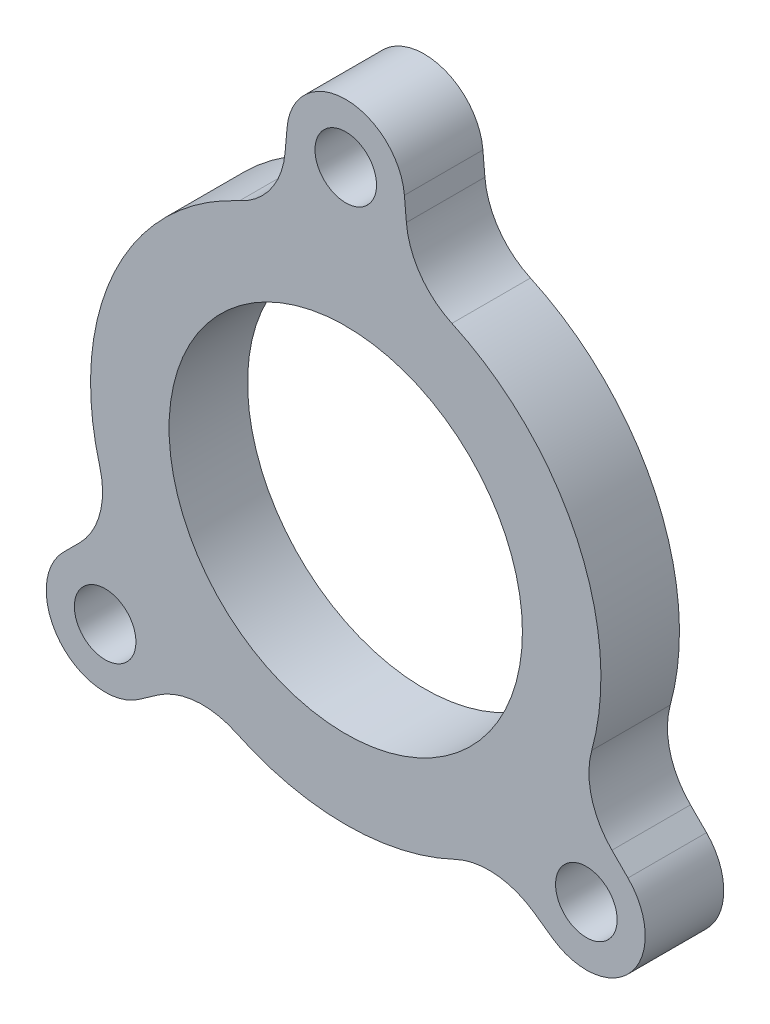
from build123d import *

# Parameters (mm, degrees)
SKETCH1_R           = 2.4892
SKETCH1_R_2         = 14.2875
BOSS_EXTRUDE1_DEPTH = 3.175
FILLET1_R           = 6.35


with BuildPart() as part:
    # Sketch1 → Boss-Extrude1 (new, symmetric)
    with BuildSketch(Plane.XY):
        with BuildLine():
            Line((-4.74437725, 25.815079225), (-5.256916026, 19.956734205))
            ThreePointArc((-5.256916026, 19.956734205), (-18.703926955, 8.721784377), (-18.666825827, -8.800910167))
            Line((-18.666825827, -8.800910167), (-22.825124901, -12.959209241))
            ThreePointArc((-22.825124901, -12.959209241), (-23.105815516, -19.388081277), (-16.725871077, -20.228016897))
            Line((-16.725871077, -20.228016897), (-11.908664854, -16.854972787))
            ThreePointArc((-11.908664854, -16.854972787), (0, -20.6375), (11.908664854, -16.854972787))
            Line((11.908664854, -16.854972787), (16.725871077, -20.228016897))
            ThreePointArc((16.725871077, -20.228016897), (23.105815516, -19.388081277), (22.825124901, -12.959209241))
            Line((22.825124901, -12.959209241), (18.666825827, -8.800910167))
            ThreePointArc((18.666825827, -8.800910167), (18.703926955, 8.721784377), (5.256916026, 19.956734205))
            Line((5.256916026, 19.956734205), (4.74437725, 25.815079225))
            ThreePointArc((4.74437725, 25.815079225), (0, 30.1625), (-4.74437725, 25.815079225))
        make_face()
        with Locations((0, 25.4)):
            Circle(SKETCH1_R, mode=Mode.SUBTRACT)
        Circle(SKETCH1_R_2, mode=Mode.SUBTRACT)
        with Locations((19.457528855, -16.326805286)):
            Circle(SKETCH1_R, mode=Mode.SUBTRACT)
        with Locations((-19.457528855, -16.326805286)):
            Circle(SKETCH1_R, mode=Mode.SUBTRACT)
    extrude(amount=BOSS_EXTRUDE1_DEPTH, both=True)

    # Fillet1
    fillet1_edges = [part.edges().sort_by_distance(p)[0] for p in [
        (18.666825827, -8.800910167, 0),
        (11.908664854, -16.854972787, 0),
        (-11.908664854, -16.854972787, 0),
        (-18.666825827, -8.800910167, 0),
        (-5.256916026, 19.956734205, 0),
        (5.256916026, 19.956734205, 0),
    ]]
    fillet(fillet1_edges, radius=FILLET1_R)


solid = part.part
